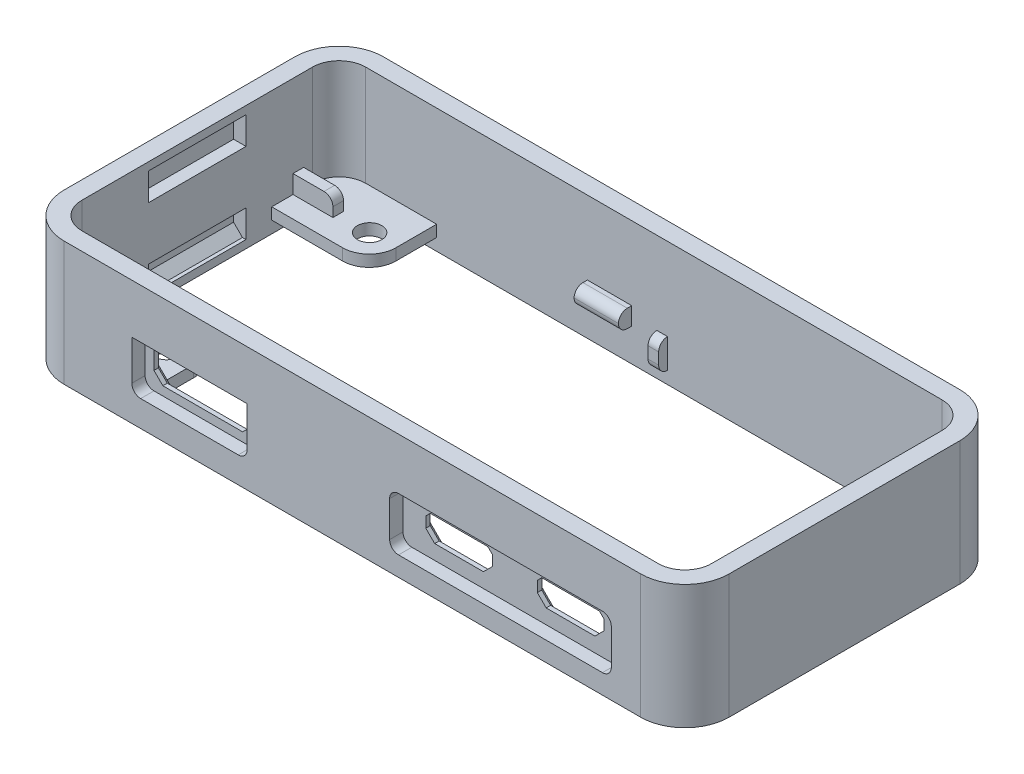
from build123d import *

# Parameters (mm, degrees)
EXTRUDE_1_DEPTH          = 12
EXTRUDE_1_DEPTH_BACK     = 2
CUT_EXTRUDE_2_DEPTH      = 45.635110658
CUT_EXTRUDE_2_DEPTH_BACK = 45.635110658
RIB_START                = -0.65
RIB_1_DEPTH              = 1.3
RIB_2_DEPTH              = 1.3
RIB_3_DEPTH              = 1.3
RIB_4_DEPTH              = 1.3
CUT_EXTRUDE_5_DEPTH      = 40
CUT_EXTRUDE_5_DEPTH_BACK = 40
SKETCH_18_R              = 1.375
SKETCH_41_W              = 13
SKETCH_41_H              = 5.5
CUT_EXTRUDE_14_DEPTH     = 1.5
SKETCH_53_W              = 1.2
SKETCH_53_H              = 3.3
EXTRUDE_15_DEPTH         = 1
FILLET_20_R              = 1
SKETCH_55_W              = 1.2
SKETCH_55_H              = 3.3
EXTRUDE_17_DEPTH         = 1.4
SKETCH_54_W              = 1.2
SKETCH_54_H              = 3.3
EXTRUDE_18_DEPTH         = 4.5
FILLET_22_R              = 1
SKETCH_59_W              = 11
SKETCH_59_H              = 12.2
CUT_EXTRUDE_24_DEPTH     = 1.4
CHAMFER_5_SIZE           = 1
SKETCH_63_W              = 1.2
SKETCH_63_H              = 3.3
EXTRUDE_21_DEPTH         = 4.5
FILLET_27_R              = 1
SKETCH_64_W              = 1.2
SKETCH_64_H              = 3.3
EXTRUDE_22_DEPTH         = 1.4
FILLET_28_R              = 1
SKETCH_65_W              = 1.2
SKETCH_65_H              = 3.3
EXTRUDE_23_DEPTH         = 0.9
FILLET_29_R              = 1
SKETCH_66_W              = 15
SKETCH_66_H              = 12.2
CUT_EXTRUDE_26_DEPTH     = 1.5
CHAMFER_10_SIZE          = 1
SKETCH_70_W              = 5
SKETCH_70_H              = 1.2
EXTRUDE_24_DEPTH         = 1.5
FILLET_31_R              = 1
SKETCH_71_W              = 5
SKETCH_71_H              = 2
EXTRUDE_25_DEPTH         = 1.5
FILLET_32_R              = 1
SKETCH_42_W              = 11
SKETCH_42_H              = 3.5
CUT_EXTRUDE_15_DEPTH     = 2.4
FILLET_33_R              = 1
SKETCH_74_W              = 16
SKETCH_74_H              = 6
EXTRUDE_26_DEPTH         = 0.5
CUT_EXTRUDE_29_REACH     = 56.445
SKETCH_46_W              = 11
SKETCH_46_H              = 3.5
CHAMFER_13_SIZE          = 1
FILLET_34_R              = 1
SKETCH_77_W              = 23.5
SKETCH_77_H              = 5
EXTRUDE_27_DEPTH         = 0.5
FILLET_39_R              = 1
CUT_EXTRUDE_31_REACH     = 56.445
SKETCH_50_W              = 7.5
SKETCH_50_H              = 2.7
CHAMFER_14_SIZE          = 1
CHAMFER_15_SIZE          = 0.5
CHAMFER_16_SIZE          = 0.5
SKETCH_78_W              = 25
SKETCH_78_H              = 6
CUT_EXTRUDE_32_DEPTH     = 1.5
FILLET_40_R              = 1
CHAMFER_17_SIZE          = 0.5
SKETCH_81_W              = 11
SKETCH_81_H              = 6
EXTRUDE_29_DEPTH         = 1.4
FILLET_41_R              = 1.5


# Read off the part's stored shape, not the designer's step: 筋1, 筋2, 筋3, 筋4
# Some blends are built 0.0001 mm under size
with BuildPart() as part:
    # case 2 → 凸台-拉伸1 (new, two sides: drawn at the far end of the back side and taken through both)
    with BuildSketch(Plane(origin=(0, 0, 0), x_dir=(1, 0, 0), z_dir=(0, 1, 0)).offset(-EXTRUDE_1_DEPTH_BACK)):
        with BuildLine():
            Line((-34.042196447, 18), (30.957803553, 18))
            ThreePointArc((30.957803553, 18), (34.493337459, 16.535533906), (35.957803553, 13))
            Line((35.957803553, 13), (35.957803553, -13))
            ThreePointArc((35.957803553, -13), (34.493337459, -16.535533906), (30.957803553, -18))
            Line((30.957803553, -18), (-34.042196447, -18))
            ThreePointArc((-34.042196447, -18), (-37.577730353, -16.535533906), (-39.042196447, -13))
            Line((-39.042196447, -13), (-39.042196447, 13))
            ThreePointArc((-39.042196447, 13), (-37.577730353, 16.535533906), (-34.042196447, 18))
        make_face()
    extrude(amount=EXTRUDE_1_DEPTH + EXTRUDE_1_DEPTH_BACK)

    # 草图13 → 切除-拉伸2 (cut, two sides: drawn at the far end of the back side and taken through both)
    with BuildSketch(Plane(origin=(0, 0, 0), x_dir=(1, 0, 0), z_dir=(0, 1, 0)).offset(-CUT_EXTRUDE_2_DEPTH_BACK)):
        with BuildLine():
            Line((-34.042196447, -16), (30.957803553, -16))
            ThreePointArc((30.957803553, -16), (33.079123896, -15.121320344), (33.957803553, -13))
            Line((33.957803553, -13), (33.957803553, 13))
            ThreePointArc((33.957803553, 13), (33.079123896, 15.121320344), (30.957803553, 16))
            Line((30.957803553, 16), (-34.042196447, 16))
            ThreePointArc((-34.042196447, 16), (-36.163516791, 15.121320344), (-37.042196447, 13))
            Line((-37.042196447, 13), (-37.042196447, -13))
            ThreePointArc((-37.042196447, -13), (-36.163516791, -15.121320344), (-34.042196447, -16))
        make_face()
    extrude(amount=CUT_EXTRUDE_2_DEPTH + CUT_EXTRUDE_2_DEPTH_BACK, mode=Mode.SUBTRACT)

    # 筋1 outline → 筋1 (add)
    with BuildSketch(Plane(origin=(0, 0, 0), x_dir=(1, 0, 0), z_dir=(0, 1, 0)).offset(RIB_START)):
        with BuildLine():
            Line((-37.042196447, 8.4), (-29.042196447, 8.4))
            ThreePointArc((-29.042196447, 8.4), (-26.920876103, 9.278679657), (-26.042196447, 11.4))
            Line((-26.042196447, 11.4), (-26.042196447, 16))
            Line((-26.042196447, 16), (-34.042196447, 16))
            ThreePointArc((-34.042196447, 16), (-36.163516791, 15.121320344), (-37.042196447, 13))
            Line((-37.042196447, 13), (-37.042196447, 8.4))
        make_face()
    extrude(amount=RIB_1_DEPTH)

    # 筋2 outline → 筋2 (add)
    with BuildSketch(Plane(origin=(0, 0, 0), x_dir=(1, 0, 0), z_dir=(0, 1, 0)).offset(RIB_START)):
        with BuildLine():
            Line((-34.042196447, -16), (-26.042196447, -16))
            Line((-26.042196447, -16), (-26.042196447, -11.4))
            ThreePointArc((-26.042196447, -11.4), (-26.920876103, -9.278679657), (-29.042196447, -8.4))
            Line((-29.042196447, -8.4), (-37.042196447, -8.4))
            Line((-37.042196447, -8.4), (-37.042196447, -13))
            ThreePointArc((-37.042196447, -13), (-36.163516791, -15.121320344), (-34.042196447, -16))
        make_face()
    extrude(amount=RIB_2_DEPTH)

    # 筋3 outline → 筋3 (add)
    with BuildSketch(Plane(origin=(0, 0, 0), x_dir=(1, 0, 0), z_dir=(0, 1, 0)).offset(RIB_START)):
        with BuildLine():
            ThreePointArc((25.957803553, 11.4), (26.836483209, 9.278679656), (28.957803553, 8.4))
            Line((28.957803553, 8.4), (33.957803553, 8.4))
            Line((33.957803553, 8.4), (33.957803553, 13))
            ThreePointArc((33.957803553, 13), (33.079123897, 15.121320343), (30.957803553, 16))
            Line((30.957803553, 16), (25.957803553, 16))
            Line((25.957803553, 16), (25.957803553, 11.4))
        make_face()
    extrude(amount=RIB_3_DEPTH)

    # 筋4 outline → 筋4 (add)
    with BuildSketch(Plane(origin=(0, 0, 0), x_dir=(1, 0, 0), z_dir=(0, 1, 0)).offset(RIB_START)):
        with BuildLine():
            Line((33.957803553, -13), (33.957803553, -8.4))
            Line((33.957803553, -8.4), (28.957803553, -8.4))
            ThreePointArc((28.957803553, -8.4), (26.836483209, -9.278679656), (25.957803553, -11.4))
            Line((25.957803553, -11.4), (25.957803553, -16))
            Line((25.957803553, -16), (30.957803553, -16))
            ThreePointArc((30.957803553, -16), (33.079123897, -15.121320343), (33.957803553, -13))
        make_face()
    extrude(amount=RIB_4_DEPTH)

    # 草图18 → 切除-拉伸5 (cut, two sides: drawn at the far end of the back side and taken through both)
    with BuildSketch(Plane(origin=(0, 0, 0), x_dir=(1, 0, 0), z_dir=(0, 1, 0)).offset(-CUT_EXTRUDE_5_DEPTH_BACK)):
        with Locations(Location((-29, 11.4, 0), (0, 0, 270))):
            Circle(SKETCH_18_R)
        with Locations(Location((-29, -11.5, 0), (0, 0, 270))):
            Circle(SKETCH_18_R)
        with Locations(Location((29, 11.4, 0), (0, 0, 270))):
            Circle(SKETCH_18_R)
        with Locations(Location((29, -11.5, 0), (0, 0, 270))):
            Circle(SKETCH_18_R)
    extrude(amount=CUT_EXTRUDE_5_DEPTH + CUT_EXTRUDE_5_DEPTH_BACK, mode=Mode.SUBTRACT)

    # 草图41 → 切除-拉伸14 (cut)
    with BuildSketch(Plane.XY.offset(18)):
        with Locations((-19.922149827, 3.68)):
            Rectangle(SKETCH_41_W, SKETCH_41_H)
    extrude(amount=-CUT_EXTRUDE_14_DEPTH, mode=Mode.SUBTRACT)

    # 草图53 → 凸台-拉伸15 (add)
    with BuildSketch(Plane.XY.offset(-16)):
        with Locations((-0.6, 1.05)):
            Rectangle(SKETCH_53_W, SKETCH_53_H)
    extrude(amount=EXTRUDE_15_DEPTH)

    # 圆角20
    fillet_20_edges = [part.edges().sort_by_distance(p)[0] for p in [
        (-0.6, -0.6, -15),
        (-0.6, 2.7, -15),
    ]]
    fillet(fillet_20_edges, radius=FILLET_20_R - 0.0001)  # a hair under: the kernel refuses the full size

    # 草图55 → 凸台-拉伸17 (add)
    with BuildSketch(Plane.ZY.offset(-33.957803553)):
        with Locations((-11.4, 1.05)):
            Rectangle(SKETCH_55_W, SKETCH_55_H)
    extrude(amount=EXTRUDE_17_DEPTH)

    # 草图54 → 凸台-拉伸18 (add)
    with BuildSketch(Plane(origin=(-37.042196447, 0, 0), x_dir=(0, 0, -1), z_dir=(1, 0, 0))):
        with Locations((11.4, 1.05)):
            Rectangle(SKETCH_54_W, SKETCH_54_H)
    extrude(amount=EXTRUDE_18_DEPTH)

    # 圆角22
    fillet_22_edges = [part.edges().sort_by_distance(p)[0] for p in [
        (32.557803553, 2.7, -11.4),
        (-32.542196447, 2.7, -11.4),
    ]]
    fillet(fillet_22_edges, radius=FILLET_22_R)

    # 草图59 → 切除-拉伸24 (cut)
    with BuildSketch(Plane(origin=(-37.042196447, 0, 0), x_dir=(0, 0, -1), z_dir=(1, 0, 0))):
        with Locations((0, 5)):
            Rectangle(SKETCH_59_W, SKETCH_59_H)
    extrude(amount=-CUT_EXTRUDE_24_DEPTH, mode=Mode.SUBTRACT)

    # 倒角5
    chamfer_5_edges = [part.edges().sort_by_distance(p)[0] for p in [
        (-38.442196447, -1.1, 0),
        (-38.442196447, 11.1, 0),
    ]]
    chamfer(chamfer_5_edges, length=CHAMFER_5_SIZE)

    # 草图63 → 凸台-拉伸21 (add)
    with BuildSketch(Plane(origin=(-37.042196447, 0, 0), x_dir=(0, 0, -1), z_dir=(1, 0, 0))):
        with Locations((-11.9, 1.05)):
            Rectangle(SKETCH_63_W, SKETCH_63_H)
    extrude(amount=EXTRUDE_21_DEPTH)

    # 圆角27
    fillet_27_edges = [part.edges().sort_by_distance(p)[0] for p in [
        (-32.542196447, 2.7, 11.9),
    ]]
    fillet(fillet_27_edges, radius=FILLET_27_R)

    # 草图64 → 凸台-拉伸22 (add)
    with BuildSketch(Plane.ZY.offset(-33.957803553)):
        with Locations((11.9, 1.05)):
            Rectangle(SKETCH_64_W, SKETCH_64_H)
    extrude(amount=EXTRUDE_22_DEPTH)

    # 圆角28
    fillet_28_edges = [part.edges().sort_by_distance(p)[0] for p in [
        (32.557803553, 2.7, 11.9),
    ]]
    fillet(fillet_28_edges, radius=FILLET_28_R)

    # 草图65 → 凸台-拉伸23 (add)
    with BuildSketch(Plane(origin=(0, 0, 16), x_dir=(-1, 0, 0), z_dir=(0, 0, -1))):
        with Locations((0.6, 1.05)):
            Rectangle(SKETCH_65_W, SKETCH_65_H)
    extrude(amount=EXTRUDE_23_DEPTH)

    # 圆角29
    # the kernel refuses this fillet: 1 mm, written as the material it takes off along each edge
    with BuildSketch(Plane(origin=(2.487468593, -0.6, 15.1), x_dir=(0, 0, 1), z_dir=(-1, 0, 0)), Plane(origin=(-3.687468593, 2.7, 15.1), x_dir=(0, 0, 1), z_dir=(1, 0, 0))) as fillet_29_piece_1:
        with BuildLine():
            CenterArc((1, 0.994987437), FILLET_29_R, 180, 84.260829523)
            Line((0, 0.994987437), (-0.02, 0.994987437))
            Line((-0.02, 0.994987437), (-0.02, 0))
            Line((-0.02, 0), (0, -0.02))
            ThreePointArc((0, -0.02), (0.45, -0.02), (0.898, -0.019899749))
            Line((0.898, -0.019899749), (0.9, 0))
        make_face()
    extrude(amount=6.174937186, mode=Mode.SUBTRACT)

    # 草图66 → 切除-拉伸26 (cut)
    with BuildSketch(Plane.ZY.offset(-33.957803553)):
        with Locations((0, 5)):
            Rectangle(SKETCH_66_W, SKETCH_66_H)
    extrude(amount=-CUT_EXTRUDE_26_DEPTH, mode=Mode.SUBTRACT)

    # 倒角10
    chamfer_10_edges = [part.edges().sort_by_distance(p)[0] for p in [
        (35.457803553, -1.1, 0),
        (35.457803553, 11.1, 0),
    ]]
    chamfer(chamfer_10_edges, length=CHAMFER_10_SIZE)

    # 草图70 → 凸台-拉伸24 (add)
    with BuildSketch(Plane(origin=(0, 0, 16), x_dir=(-1, 0, 0), z_dir=(0, 0, -1))):
        with Locations((6.542196447, 2.45)):
            Rectangle(SKETCH_70_W, SKETCH_70_H)
    extrude(amount=EXTRUDE_24_DEPTH)

    # 圆角31
    fillet_31_edges = [part.edges().sort_by_distance(p)[0] for p in [
        (-6.542196447, 3.05, 14.5),
    ]]
    fillet(fillet_31_edges, radius=FILLET_31_R)

    # 草图71 → 凸台-拉伸25 (add)
    with BuildSketch(Plane.XY.offset(-16)):
        with Locations((-6.537335394, 2.7)):
            Rectangle(SKETCH_71_W, SKETCH_71_H)
    extrude(amount=EXTRUDE_25_DEPTH)

    # 圆角32
    fillet_32_edges = [part.edges().sort_by_distance(p)[0] for p in [
        (-6.537335394, 1.7, -14.5),
        (-6.537335394, 3.7, -14.5),
    ]]
    fillet(fillet_32_edges, radius=FILLET_32_R - 0.0001)  # a hair under: the kernel refuses the full size

    # 草图42 → 切除-拉伸15 (cut)
    with BuildSketch(Plane.XY.offset(18)):
        with Locations((-19.922149827, 3.68)):
            Rectangle(SKETCH_42_W, SKETCH_42_H)
    extrude(amount=-CUT_EXTRUDE_15_DEPTH, mode=Mode.SUBTRACT)

    # 圆角33
    fillet_33_edges = [part.edges().sort_by_distance(p)[0] for p in [
        (-13.422149827, 0.93, 17.25),
        (-26.422149827, 0.93, 17.25),
    ]]
    fillet(fillet_33_edges, radius=FILLET_33_R)

    # 草图74 → 凸台-拉伸26 (add)
    with BuildSketch(Plane(origin=(0, 0, 16), x_dir=(-1, 0, 0), z_dir=(0, 0, -1))):
        with Locations((20.042196447, 4)):
            Rectangle(SKETCH_74_W, SKETCH_74_H)
    extrude(amount=EXTRUDE_26_DEPTH)

    # 草图46 → 切除-拉伸29 (cut, up to next)
    with BuildSketch(Plane.XY.offset(18), mode=Mode.PRIVATE) as cut_extrude_29_sk1:
        with Locations((-19.922149827, 3.68)):
            Rectangle(SKETCH_46_W, SKETCH_46_H)
    cut_extrude_29_tool1 = extrude(cut_extrude_29_sk1.sketch, amount=-CUT_EXTRUDE_29_REACH, mode=Mode.PRIVATE) & part.part
    add(cut_extrude_29_tool1.solids().sort_by_distance((-19.92215, 3.68, 18))[0], mode=Mode.SUBTRACT)

    # 倒角13
    chamfer_13_edges = [part.edges().sort_by_distance(p)[0] for p in [
        (-25.422149827, 1.93, 16),
        (-14.422149827, 1.93, 16),
    ]]
    chamfer(chamfer_13_edges, length=CHAMFER_13_SIZE)

    # 圆角34
    fillet_34_edges = [part.edges().sort_by_distance(p)[0] for p in [
        (-12.042196447, 7, 15.75),
        (-12.042196447, 1, 15.75),
        (-28.042196447, 1, 15.75),
        (-28.042196447, 7, 15.75),
    ]]
    fillet(fillet_34_edges, radius=FILLET_34_R)

    # 草图77 → 凸台-拉伸27 (add)
    with BuildSketch(Plane(origin=(0, 0, 16), x_dir=(-1, 0, 0), z_dir=(0, 0, -1))):
        with Locations((-15.207803553, 3.4)):
            Rectangle(SKETCH_77_W, SKETCH_77_H)
    extrude(amount=EXTRUDE_27_DEPTH)

    # 圆角39
    fillet_39_edges = [part.edges().sort_by_distance(p)[0] for p in [
        (26.957803553, 5.9, 15.75),
        (26.957803553, 0.9, 15.75),
        (3.457803553, 0.9, 15.75),
        (3.457803553, 5.9, 15.75),
    ]]
    fillet(fillet_39_edges, radius=FILLET_39_R)

    # 草图50 → 切除-拉伸31 (cut, up to next)
    with BuildSketch(Plane.XY.offset(18), mode=Mode.PRIVATE) as cut_extrude_31_sk1:
        with Locations((21.563738428, 3.198192542)):
            Rectangle(SKETCH_50_W, SKETCH_50_H)
    cut_extrude_31_tool1 = extrude(cut_extrude_31_sk1.sketch, amount=-CUT_EXTRUDE_31_REACH, mode=Mode.PRIVATE) & part.part
    # 草图50 → 切除-拉伸31 (cut, up to next)
    with BuildSketch(Plane.XY.offset(18), mode=Mode.PRIVATE) as cut_extrude_31_sk2:
        with Locations((8.984862183, 3.198192542)):
            Rectangle(SKETCH_50_W, SKETCH_50_H)
    cut_extrude_31_tool2 = extrude(cut_extrude_31_sk2.sketch, amount=-CUT_EXTRUDE_31_REACH, mode=Mode.PRIVATE) & part.part
    add(cut_extrude_31_tool1.solids().sort_by_distance((21.563738, 3.198193, 18))[0], mode=Mode.SUBTRACT)
    add(cut_extrude_31_tool2.solids().sort_by_distance((8.984862, 3.198193, 18))[0], mode=Mode.SUBTRACT)

    # 倒角14
    chamfer_14_edges = [part.edges().sort_by_distance(p)[0] for p in [
        (17.813738428, 1.848192542, 16.75),
        (25.313738428, 1.848192542, 16.75),
        (12.734862183, 1.848192542, 16.75),
        (5.234862183, 1.848192542, 16.75),
    ]]
    chamfer(chamfer_14_edges, length=CHAMFER_14_SIZE)

    # 倒角15
    chamfer_15_edges = [part.edges().sort_by_distance(p)[0] for p in [
        (25.313738428, 4.548192542, 16.75),
        (17.813738428, 4.548192542, 16.75),
        (12.734862183, 4.548192542, 16.75),
        (5.234862183, 4.548192542, 16.75),
    ]]
    chamfer(chamfer_15_edges, length=CHAMFER_15_SIZE)

    # 倒角16
    chamfer_16_edges = [part.edges().sort_by_distance(p)[0] for p in [
        (25.313738428, 3.448192542, 15.5),
        (21.563738428, 1.848192542, 15.5),
        (12.734862183, 3.448192542, 15.5),
        (8.984862183, 1.848192542, 15.5),
        (24.813738428, 2.348192542, 15.5),
        (18.313738428, 2.348192542, 15.5),
        (12.234862183, 2.348192542, 15.5),
        (5.734862183, 2.348192542, 15.5),
        (21.563738428, 4.548192542, 15.5),
        (17.813738428, 3.448192542, 15.5),
        (8.984862183, 4.548192542, 15.5),
        (5.234862183, 3.448192542, 15.5),
        (25.063738428, 4.298192542, 15.5),
        (18.063738428, 4.298192542, 15.5),
        (12.484862183, 4.298192542, 15.5),
        (5.484862183, 4.298192542, 15.5),
    ]]
    chamfer(chamfer_16_edges, length=CHAMFER_16_SIZE)

    # 草图78 → 切除-拉伸32 (cut)
    with BuildSketch(Plane.XY.offset(18)):
        with Locations((15.157803553, 3.2)):
            Rectangle(SKETCH_78_W, SKETCH_78_H)
    extrude(amount=-CUT_EXTRUDE_32_DEPTH, mode=Mode.SUBTRACT)

    # 圆角40
    fillet_40_edges = [part.edges().sort_by_distance(p)[0] for p in [
        (2.657803553, 0.2, 17.25),
        (2.657803553, 6.2, 17.25),
        (27.657803553, 6.2, 17.25),
        (27.657803553, 0.2, 17.25),
    ]]
    fillet(fillet_40_edges, radius=FILLET_40_R)

    # 倒角17
    chamfer_17_edges = [part.edges().sort_by_distance(p)[0] for p in [
        (-19.922149827, 5.43, 15.5),
        (-25.422149827, 4.18, 15.5),
        (-14.422149827, 4.18, 15.5),
        (-19.922149827, 1.93, 15.5),
        (-14.922149827, 2.43, 15.5),
        (-24.922149827, 2.43, 15.5),
    ]]
    chamfer(chamfer_17_edges, length=CHAMFER_17_SIZE)

    # 草图81 → 凸台-拉伸29 (add)
    with BuildSketch(Plane(origin=(-38.442196447, 0, 0), x_dir=(0, 0, -1), z_dir=(1, 0, 0))):
        with Locations((0, 5)):
            Rectangle(SKETCH_81_W, SKETCH_81_H)
    extrude(amount=EXTRUDE_29_DEPTH)

    # 圆角41
    fillet_41_edges = [part.edges().sort_by_distance(p)[0] for p in [
        (35.457803553, 5, 7.5),
        (35.457803553, 5, -7.5),
    ]]
    fillet(fillet_41_edges, radius=FILLET_41_R - 0.0001)  # a hair under: the kernel refuses the full size


solid = part.part
